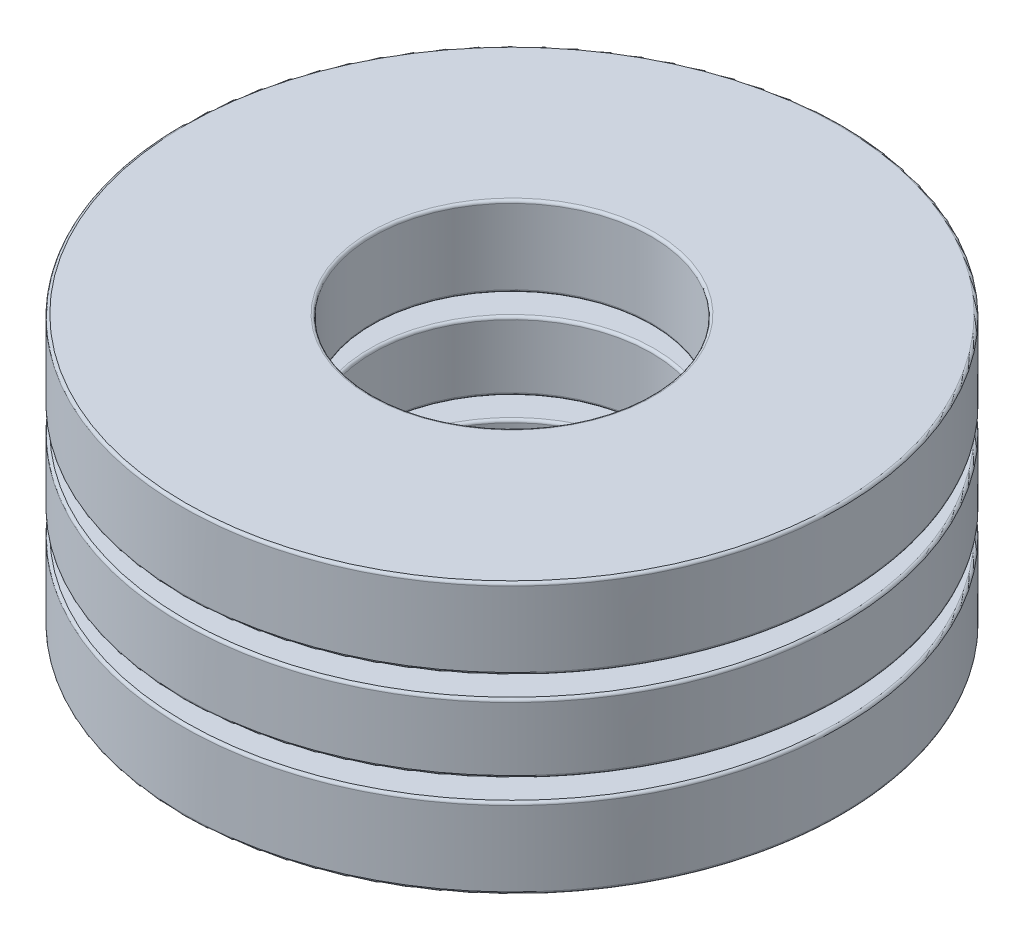
from build123d import *

# Parameters (mm, degrees)
SKETCH1_W         = 3.462
SKETCH1_H         = 1.25
CIRPATTERN1_COUNT = 7
CIRPATTERN1_ANGLE = 308.571428571
CIRPATTERN2_COUNT = 7
SKETCH4_W         = 3.462
SKETCH4_H         = 1.46
FILLET1_R         = 0.0492
FILLET2_R         = 0.0492
FILLET3_R         = 0.0492


with BuildPart() as part:
    # Sketch1 → Revolve1 (revolve)
    with BuildSketch(Plane(origin=(0, 0, 0), x_dir=(0, 0, -1), z_dir=(1, 0, 0))):
        with Locations((-4.269, 0)):
            Rectangle(SKETCH1_W, SKETCH1_H)
    revolve(axis=Axis((0, -2.46, 0), (0, 1, 0)))

    # Sketch3 → Cut-Revolve1 (revolve, cut)
    with BuildSketch(Plane(origin=(0, 0, 0), x_dir=(0, 0, -1), z_dir=(1, 0, 0))):
        with BuildLine():
            Line((-4.5, 1.0625), (-4.5, -1.0625))
            ThreePointArc((-4.5, -1.0625), (-5.5625, 0), (-4.5, 1.0625))
        make_face()
    cut_revolve1 = revolve(axis=Axis((0, 1.0625, 4.5), (0, -1, 0)), mode=Mode.SUBTRACT)

    # CirPattern2: Cut-Revolve1 ×7 about axis
    cirpattern2_axis = Axis((0, 2.46, 0), (0, -1, 0))
    for i in range(1, CIRPATTERN2_COUNT):
        add(cut_revolve1.rotate(cirpattern2_axis, i * 360 / CIRPATTERN2_COUNT), mode=Mode.SUBTRACT)

    # Fillet2
    fillet2_edges = [part.edges().sort_by_distance(p)[0] for p in [
        (0, -0.625, -2.538),
        (0, 0.625, -2.538),
        (0, -0.625, -6),
        (0, 0.625, -6),
    ]]
    fillet(fillet2_edges, radius=FILLET2_R)


with BuildPart() as body_2:
    # Sketch2 → Revolve2 (revolve)
    with BuildSketch(Plane(origin=(0, 0, 0), x_dir=(0, 0, -1), z_dir=(1, 0, 0))):
        with BuildLine():
            Line((-4.5, 1), (-4.5, -1))
            ThreePointArc((-4.5, -1), (-5.5, 0), (-4.5, 1))
        make_face()
    revolve(axis=Axis((0, 1, 4.5), (0, -1, 0)))


with BuildPart() as cirpattern1_1:
    # CirPattern1: pattern copy
    add(body_2.part.rotate(Axis((0, 2.46, 0), (0, -1, 0)), 1 * CIRPATTERN1_ANGLE / (CIRPATTERN1_COUNT - 1)))


with BuildPart() as cirpattern1_2:
    # CirPattern1: pattern copy
    add(body_2.part.rotate(Axis((0, 2.46, 0), (0, -1, 0)), 2 * CIRPATTERN1_ANGLE / (CIRPATTERN1_COUNT - 1)))


with BuildPart() as cirpattern1_3:
    # CirPattern1: pattern copy
    add(body_2.part.rotate(Axis((0, 2.46, 0), (0, -1, 0)), 3 * CIRPATTERN1_ANGLE / (CIRPATTERN1_COUNT - 1)))


with BuildPart() as cirpattern1_4:
    # CirPattern1: pattern copy
    add(body_2.part.rotate(Axis((0, 2.46, 0), (0, -1, 0)), 4 * CIRPATTERN1_ANGLE / (CIRPATTERN1_COUNT - 1)))


with BuildPart() as cirpattern1_5:
    # CirPattern1: pattern copy
    add(body_2.part.rotate(Axis((0, 2.46, 0), (0, -1, 0)), 5 * CIRPATTERN1_ANGLE / (CIRPATTERN1_COUNT - 1)))


with BuildPart() as cirpattern1_6:
    # CirPattern1: pattern copy
    add(body_2.part.rotate(Axis((0, 2.46, 0), (0, -1, 0)), 6 * CIRPATTERN1_ANGLE / (CIRPATTERN1_COUNT - 1)))


with BuildPart() as body_9:
    # Sketch4 → Revolve3 (revolve)
    with BuildSketch(Plane(origin=(0, 0, 0), x_dir=(0, 0, -1), z_dir=(1, 0, 0))):
        with Locations((-4.269, 1.73)):
            Rectangle(SKETCH4_W, SKETCH4_H)
        with Locations((-4.269, -1.73)):
            Rectangle(SKETCH4_W, SKETCH4_H)
    revolve(axis=Axis((0, -2.46, 0), (0, 1, 0)))

    # Fillet1
    fillet1_edges = [body_9.edges().sort_by_distance(p)[0] for p in [
        (0, 1, -2.538),
        (0, 2.46, -2.538),
        (0, 1, -6),
        (0, 2.46, -6),
    ]]
    fillet(fillet1_edges, radius=FILLET1_R)

    # Fillet3
    fillet3_edges = [body_9.edges().sort_by_distance(p)[0] for p in [
        (0, -2.46, -2.538),
        (0, -1, -2.538),
        (0, -2.46, -6),
        (0, -1, -6),
    ]]
    fillet(fillet3_edges, radius=FILLET3_R)


solid = Compound([part.part, body_2.part, cirpattern1_1.part, cirpattern1_2.part, cirpattern1_3.part, cirpattern1_4.part, cirpattern1_5.part, cirpattern1_6.part, body_9.part])
